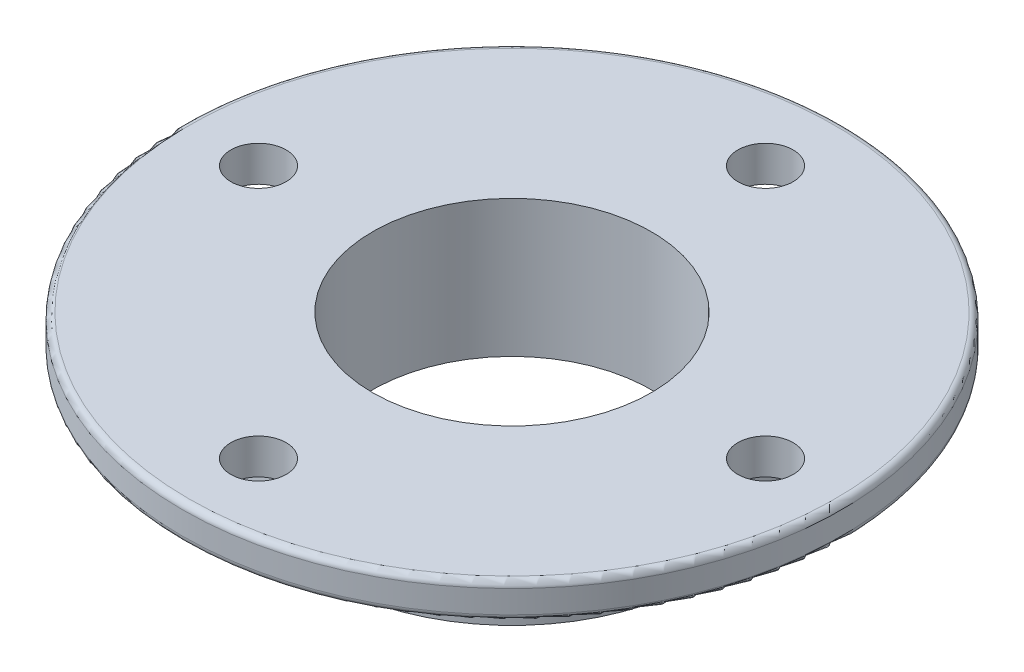
from build123d import *

# Parameters (mm, degrees)
SKETCH1_R           = 7.5
SKETCH1_R_2         = 5.5
BOSS_EXTRUDE1_DEPTH = 4
SKETCH2_R           = 13
SKETCH2_R_2         = 5.5
BOSS_EXTRUDE2_DEPTH = 1.4
SKETCH3_R           = 1.09
CUT_EXTRUDE1_DEPTH  = 20.161419572
CIRPATTERN1_COUNT   = 4
FILLET1_R           = 0.25


with BuildPart() as part:
    # Sketch1 → Boss-Extrude1 (new body)
    with BuildSketch(Plane(origin=(0, 0, 0), x_dir=(1, 0, 0), z_dir=(0, 1, 0))):
        Circle(SKETCH1_R)
        Circle(SKETCH1_R_2, mode=Mode.SUBTRACT)
    extrude(amount=BOSS_EXTRUDE1_DEPTH)

    # Sketch2 → Boss-Extrude2 (add)
    with BuildSketch(Plane(origin=(0, 4, 0), x_dir=(1, 0, 0), z_dir=(0, 1, 0))):
        Circle(SKETCH2_R)
        Circle(SKETCH2_R_2, mode=Mode.SUBTRACT)
    extrude(amount=BOSS_EXTRUDE2_DEPTH)

    # Sketch3 → Cut-Extrude1 (cut, through all)
    with BuildSketch(Plane(origin=(0, 5.4, 0), x_dir=(1, 0, 0), z_dir=(0, 1, 0))):
        with Locations((0, 10)):
            Circle(SKETCH3_R)
    cut_extrude1 = extrude(amount=-CUT_EXTRUDE1_DEPTH, mode=Mode.SUBTRACT)

    # CirPattern1: Cut-Extrude1 ×4 about axis
    cirpattern1_axis = Axis((0, 4, 0), (0, -1, 0))
    for i in range(1, CIRPATTERN1_COUNT):
        add(cut_extrude1.rotate(cirpattern1_axis, i * 360 / CIRPATTERN1_COUNT), mode=Mode.SUBTRACT)

    # Fillet1
    fillet1_edges = [part.edges().sort_by_distance(p)[0] for p in [
        (-13, 5.4, 0),
        (-13, 4, 0),
    ]]
    fillet(fillet1_edges, radius=FILLET1_R)


solid = part.part
